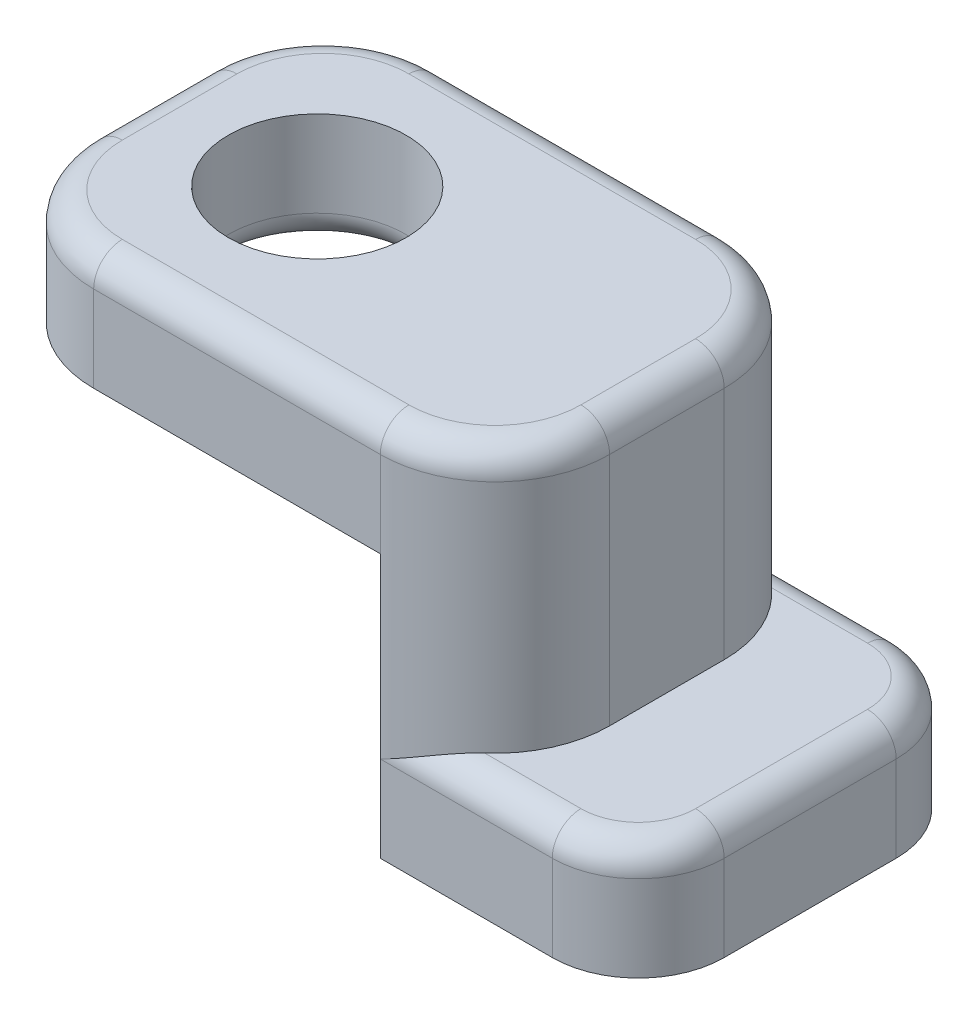
from build123d import *

# Parameters (mm, degrees)
BOSS_EXTRUDE1_DEPTH     = 2
CUT_EXTRUDE1_DEPTH      = 6.766281297
CUT_EXTRUDE1_DEPTH_BACK = 6.766281297
SKETCH2_R               = 1.55
BOSS_EXTRUDE2_START     = 4.6
BOSS_EXTRUDE2_DEPTH     = 4.6
BOSS_EXTRUDE3_DEPTH     = 2
FILLET1_R               = 0.5


with BuildPart() as part:
    # Sketch1 → Boss-Extrude1 (new body)
    with BuildSketch(Plane(origin=(0, 0, 0), x_dir=(1, 0, 0), z_dir=(0, 1, 0))):
        with BuildLine():
            Line((2.5, 3), (-2.5, 3))
            ThreePointArc((-2.5, 3), (-3.914213562, 2.414213562), (-4.5, 1))
            Line((-4.5, 1), (-4.5, -1))
            ThreePointArc((-4.5, -1), (-3.914213562, -2.414213562), (-2.5, -3))
            Line((-2.5, -3), (2.5, -3))
            ThreePointArc((2.5, -3), (3.914213562, -2.414213562), (4.5, -1))
            Line((4.5, -1), (4.5, 1))
            ThreePointArc((4.5, 1), (3.914213562, 2.414213562), (2.5, 3))
        make_face()
    extrude(amount=BOSS_EXTRUDE1_DEPTH)

    # Sketch2 → Cut-Extrude1 (cut, two sides: drawn at the far end of the back side and taken through both)
    with BuildSketch(Plane(origin=(0, 2, 0), x_dir=(1, 0, 0), z_dir=(0, 1, 0)).offset(-CUT_EXTRUDE1_DEPTH_BACK)):
        with Locations(Location((-1.6, 0, 0), (0, 0, 270))):
            Circle(SKETCH2_R)
    extrude(amount=CUT_EXTRUDE1_DEPTH + CUT_EXTRUDE1_DEPTH_BACK, mode=Mode.SUBTRACT)

    # Sketch3 → Boss-Extrude2 (add)
    with BuildSketch(Plane.XZ.offset(BOSS_EXTRUDE2_START)):
        with BuildLine():
            Line((4.5, 1), (4.5, -1))
            ThreePointArc((4.5, -1), (3.914213562, -2.414213562), (2.5, -3))
            Line((2.5, -3), (2.5, 3))
            ThreePointArc((2.5, 3), (3.914213562, 2.414213562), (4.5, 1))
        make_face()
    extrude(amount=-BOSS_EXTRUDE2_DEPTH)

    # Sketch4 → Boss-Extrude3 (add)
    with BuildSketch(Plane.XZ.offset(4.6)):
        with BuildLine():
            Line((4.5, 1), (4.5, -1))
            ThreePointArc((4.5, -1), (3.914213562, -2.414213562), (2.5, -3))
            Line((2.5, -3), (5.5, -3))
            ThreePointArc((5.5, -3), (6.560660172, -2.560660172), (7, -1.5))
            Line((7, -1.5), (7, 1.5))
            ThreePointArc((7, 1.5), (6.560660172, 2.560660172), (5.5, 3))
            Line((5.5, 3), (2.5, 3))
            ThreePointArc((2.5, 3), (3.914213562, 2.414213562), (4.5, 1))
        make_face()
    extrude(amount=-BOSS_EXTRUDE3_DEPTH)

    # Fillet1
    # the kernel refuses this fillet: 0.5 mm, written as the material it takes off along each edge
    with BuildSketch(Plane(origin=(-2.5, 2, 1), x_dir=(-1, 0, 0), z_dir=(0, 0, -1))) as fillet1_piece_1:
        with BuildLine():
            CenterArc((2 - FILLET1_R, -FILLET1_R), FILLET1_R, 0, 90)
            Line((2, -FILLET1_R), (2, 0))
            Line((2, 0), (2 - FILLET1_R, 0))
        make_face()
    revolve(axis=Axis((-2.5, 2, 1), (0, 1, 0)), revolution_arc=90, mode=Mode.SUBTRACT)
    with BuildSketch(Plane(origin=(-2.5, 2, 3), x_dir=(0, 0, -1), z_dir=(1, 0, 0)), Plane(origin=(2.5, 2, -3), x_dir=(0, 0, 1), z_dir=(-1, 0, 0))) as fillet1_piece_2:
        with BuildLine():
            CenterArc((FILLET1_R, -FILLET1_R), FILLET1_R, 90, 90)
            Line((0, -FILLET1_R), (0, 0))
            Line((0, 0), (FILLET1_R, 0))
        make_face()
    extrude(amount=5, mode=Mode.SUBTRACT)
    with BuildSketch(Plane(origin=(2.5, 2, 1), x_dir=(0, 0, 1), z_dir=(-1, 0, 0))) as fillet1_piece_3:
        with BuildLine():
            CenterArc((2 - FILLET1_R, -FILLET1_R), FILLET1_R, 0, 90)
            Line((2 - FILLET1_R, 0), (2, 0))
            Line((2, 0), (2, -FILLET1_R))
        make_face()
    revolve(axis=Axis((2.5, 2, 1), (0, 1, 0)), revolution_arc=90, mode=Mode.SUBTRACT)
    with BuildSketch(Plane(origin=(4.5, 2, 1), x_dir=(0, -1, 0), z_dir=(0, 0, -1))) as fillet1_piece_4:
        with BuildLine():
            CenterArc((FILLET1_R, FILLET1_R), FILLET1_R, 180, 90)
            Line((0, FILLET1_R), (0, 0))
            Line((0, 0), (FILLET1_R, 0))
        make_face()
    extrude(amount=2, mode=Mode.SUBTRACT)
    with BuildSketch(Plane(origin=(-1.6, 0, 0), x_dir=(0, 0, 1), z_dir=(-1, 0, 0))) as fillet1_piece_5:
        with BuildLine():
            CenterArc((1.55 + FILLET1_R, FILLET1_R), FILLET1_R, 180, 90)
            Line((1.55 + FILLET1_R, 0), (1.55, 0))
            Line((1.55, 0), (1.55, FILLET1_R))
        make_face()
    revolve(axis=Axis((-1.6, 0, 0), (0, 1, 0)), mode=Mode.SUBTRACT)
    with BuildSketch(Plane(origin=(2.5, 2, -1), x_dir=(1, 0, 0), z_dir=(0, 0, 1))) as fillet1_piece_6:
        with BuildLine():
            CenterArc((2 - FILLET1_R, -FILLET1_R), FILLET1_R, 0, 90)
            Line((2 - FILLET1_R, 0), (2, 0))
            Line((2, 0), (2, -FILLET1_R))
        make_face()
    revolve(axis=Axis((2.5, 2, -1), (0, 1, 0)), revolution_arc=90, mode=Mode.SUBTRACT)
    with BuildSketch(Plane(origin=(5.5, -2.6, 3), x_dir=(0, 0, -1), z_dir=(-1, 0, 0))) as fillet1_piece_7_section:
        with BuildLine():
            CenterArc((FILLET1_R, FILLET1_R), FILLET1_R, 180, 90)
            Line((0, FILLET1_R), (0, 0))
            Line((0, 0), (FILLET1_R, 0))
        make_face()
    fillet1_piece_7 = extrude(amount=4.25, mode=Mode.PRIVATE)
    fillet1_piece_7 = fillet1_piece_7 - Plane(origin=(2.5, -2.684531393, 1), x_dir=(0, 0, 1), z_dir=(0, -1, 0)) * Cylinder(2, 11, mode=Mode.PRIVATE)
    add(fillet1_piece_7, mode=Mode.SUBTRACT)
    with BuildSketch(Plane(origin=(5.5, -2.6, 1.5), x_dir=(1, 0, 0), z_dir=(0, 0, -1))) as fillet1_piece_8:
        with BuildLine():
            CenterArc((1.5 - FILLET1_R, FILLET1_R), FILLET1_R, 270, 90)
            Line((1.5, FILLET1_R), (1.5, 0))
            Line((1.5, 0), (1.5 - FILLET1_R, 0))
        make_face()
    revolve(axis=Axis((5.5, -2.6, 1.5), (0, -1, 0)), revolution_arc=90, mode=Mode.SUBTRACT)
    with BuildSketch(Plane(origin=(7, -2.6, -1.5), x_dir=(-1, 0, 0), z_dir=(0, 0, 1))) as fillet1_piece_9:
        with BuildLine():
            CenterArc((FILLET1_R, FILLET1_R), FILLET1_R, 180, 90)
            Line((0, FILLET1_R), (0, 0))
            Line((0, 0), (FILLET1_R, 0))
        make_face()
    extrude(amount=3, mode=Mode.SUBTRACT)
    with BuildSketch(Plane(origin=(5.5, -2.6, -1.5), x_dir=(0, 0, -1), z_dir=(-1, 0, 0))) as fillet1_piece_10:
        with BuildLine():
            CenterArc((1.5 - FILLET1_R, FILLET1_R), FILLET1_R, 270, 90)
            Line((1.5, FILLET1_R), (1.5, 0))
            Line((1.5, 0), (1.5 - FILLET1_R, 0))
        make_face()
    revolve(axis=Axis((5.5, -2.6, -1.5), (0, -1, 0)), revolution_arc=90, mode=Mode.SUBTRACT)
    with BuildSketch(Plane(origin=(1.25, -2.6, -3), x_dir=(0, 0, 1), z_dir=(1, 0, 0))) as fillet1_piece_11_section:
        with BuildLine():
            CenterArc((FILLET1_R, FILLET1_R), FILLET1_R, 180, 90)
            Line((0, FILLET1_R), (0, 0))
            Line((0, 0), (FILLET1_R, 0))
        make_face()
    fillet1_piece_11 = extrude(amount=4.25, mode=Mode.PRIVATE)
    fillet1_piece_11 = fillet1_piece_11 - Plane(origin=(2.5, -2.72746411, -1), x_dir=(1, 0, 0), z_dir=(0, -1, 0)) * Cylinder(2, 11, mode=Mode.PRIVATE)
    add(fillet1_piece_11, mode=Mode.SUBTRACT)
    with BuildSketch(Plane(origin=(-2.5, 2, -1), x_dir=(0, 0, -1), z_dir=(1, 0, 0))) as fillet1_piece_12:
        with BuildLine():
            CenterArc((2 - FILLET1_R, -FILLET1_R), FILLET1_R, 0, 90)
            Line((2, -FILLET1_R), (2, 0))
            Line((2, 0), (2 - FILLET1_R, 0))
        make_face()
    revolve(axis=Axis((-2.5, 2, -1), (0, 1, 0)), revolution_arc=90, mode=Mode.SUBTRACT)
    with BuildSketch(Plane(origin=(-4.5, 2, -1), x_dir=(1, 0, 0), z_dir=(0, 0, 1))) as fillet1_piece_13:
        with BuildLine():
            CenterArc((FILLET1_R, -FILLET1_R), FILLET1_R, 90, 90)
            Line((0, -FILLET1_R), (0, 0))
            Line((0, 0), (FILLET1_R, 0))
        make_face()
    extrude(amount=2, mode=Mode.SUBTRACT)


solid = part.part
